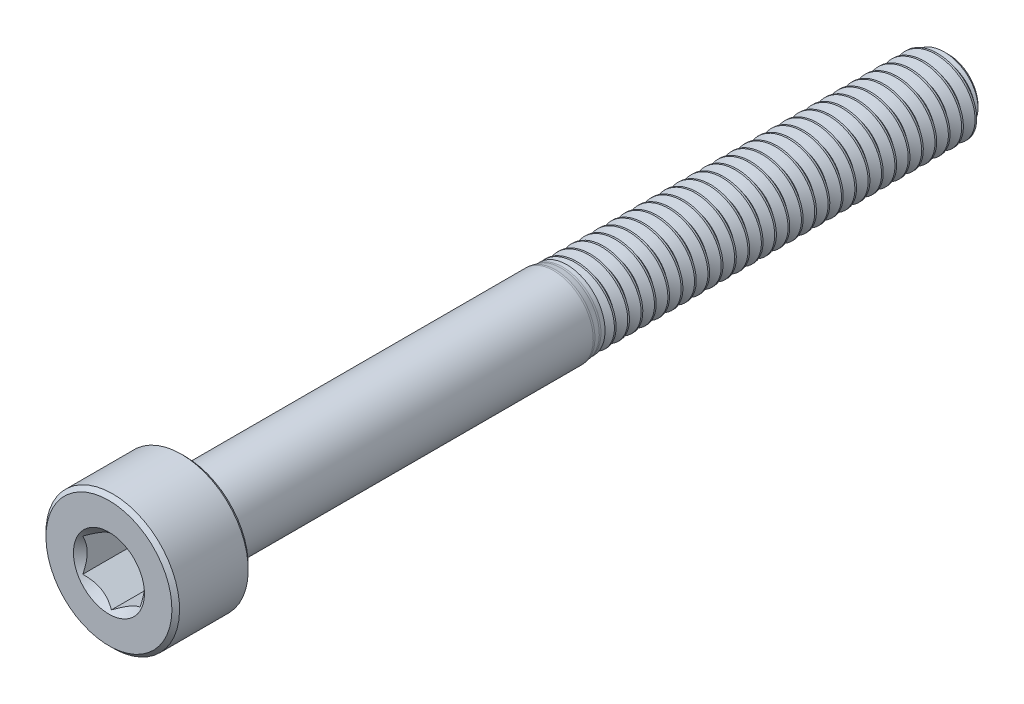
from build123d import *

# Parameters (mm, degrees)
CUT_EXTRUDE1_DEPTH     = 3
SPLIT1_SURFACE_1_BACK  = 46.1
SPLIT1_SURFACE_1_DEPTH = 92.2
SPLIT1_SURFACE_2_BACK  = 46.1
SPLIT1_SURFACE_2_DEPTH = 92.2
CUT_SWEEP1_PITCH       = 0.7
CUT_SWEEP1_TO          = 20


with BuildPart() as part:
    # Sketch2 → Revolve1 (revolve)
    with BuildSketch(Plane(origin=(0, 0, 0), x_dir=(0, 0, -1), z_dir=(1, 0, 0))):
        with BuildLine():
            Line((-22, 0), (-22, 3.3))
            Line((-22, 3.3), (-21.8, 3.5))
            Line((-21.8, 3.5), (-18.2, 3.5))
            Line((-18.2, 3.5), (-18, 3.3))
            Line((-18, 3.3), (-18, 2.275777223))
            ThreePointArc((-18, 2.275777223), (-17.941421356, 2.134355867), (-17.8, 2.075777223))
            Line((-17.8, 2.075777223), (1.307296473, 2.075777223))
            ThreePointArc((1.307296473, 2.075777223), (1.356305044, 2.073369586), (1.404841634, 2.066169863))
            Line((1.404841634, 2.066169863), (1.689200541, 2.00960736))
            ThreePointArc((1.689200541, 2.00960736), (1.737737132, 2.002407637), (1.786745702, 2))
            Line((1.786745702, 2), (21.545336663, 2))
            Line((21.545336663, 2), (22, 1.545336663))
            Line((22, 1.545336663), (22, 0))
            Line((22, 0), (-22, 0))
        make_face()
    revolve(axis=Axis((0, 0, -22), (0, 0, 1)))

    # Sketch3 → Cut-Extrude1 (cut)
    with BuildSketch(Plane.XY.offset(22)):
        Polygon((1.5, -0.866025404), (1.5, 0.866025404), (0, 1.732050808), (-1.5, 0.866025404), (-1.5, -0.866025404), (0, -1.732050808), align=None)
    extrude(amount=-CUT_EXTRUDE1_DEPTH, mode=Mode.SUBTRACT)

    # Cut-Extrude2 cone 1 section (through the dimple's axis) → Cut-Extrude2 (revolve, cut)
    with BuildSketch(Plane(origin=(0, 0, 22), x_dir=(0, -1, 0), z_dir=(1, 0, 0))):
        Polygon((0, 0), (1.861954618, 0), (0, 1.861954618), align=None)
    revolve(axis=Axis((0, 0, 22), (0, 0, -1)), mode=Mode.SUBTRACT)


with BuildPart() as body_2:
    # Split1: the piece behind the surface
    add(part.part)
    # Split1 surface: a surface, the sketch's curves swept straight by 92.2 mm
    with BuildLine(Plane(origin=(0, 0, 0), x_dir=(0, 0, -1), z_dir=(1, 0, 0)).offset(-SPLIT1_SURFACE_1_BACK), mode=Mode.PRIVATE) as split1_surface_1_path:
        Line((2, -2), (2, 2))
    split1_surface_1 = Shell.extrude(split1_surface_1_path.wire(), (1 * SPLIT1_SURFACE_1_DEPTH, 0 * SPLIT1_SURFACE_1_DEPTH, 0 * SPLIT1_SURFACE_1_DEPTH))
    split(bisect_by=split1_surface_1, keep=Keep.BOTTOM)

    # Cut-Sweep1: arcs per turn and ends read off the stored shape
    # Cut-Sweep1: the profile of Sketch7 screwed along a right-hand helix through 29.571429 turns, 6 arcs to a turn; built about Z, then put on its axis
    cut_sweep1_z = Axis((0, 0, 0), (0, 0, 1))
    cut_sweep1_corners = [(2.037888611, 0, 0.021875), (2.037888611, 0, -0.634375), (1.545336663, 0, -0.35), (1.545336663, 0, -0.2625)]
    with BuildLine(mode=Mode.PRIVATE) as cut_sweep1_profile:
        Line(cut_sweep1_corners[0], cut_sweep1_corners[1])
        Line(cut_sweep1_corners[1], cut_sweep1_corners[2])
        Line(cut_sweep1_corners[2], cut_sweep1_corners[3])
        Line(cut_sweep1_corners[3], cut_sweep1_corners[0])
    cut_sweep1_cap = Face(cut_sweep1_profile.wire())
    cut_sweep1_turn_angles = [0, 30, 60, 90, 120, 150, 180, 210, 240, 270, 300, 330, 360]
    cut_sweep1_turn_weights = [1, 0.8660254037844387, 1, 0.8660254037844387, 1, 0.8660254037844387, 1, 0.8660254037844387, 1, 0.8660254037844387, 1, 0.8660254037844387, 1]
    cut_sweep1_turn_rails = [Edge.make_bspline([Vector(p[0], p[1], 0).rotate(cut_sweep1_z, cut_sweep1_turn_angles[k]) / cut_sweep1_turn_weights[k] + Vector(0, 0, p[2] + CUT_SWEEP1_PITCH * cut_sweep1_turn_angles[k] / 360) for k in range(13)], [0, 0, 0, 1, 1, 2, 2, 3, 3, 4, 4, 5, 5, 6, 6, 6], 2, cut_sweep1_turn_weights) for p in cut_sweep1_corners]
    cut_sweep1_turn_sides = [Face.make_surface_from_curves(cut_sweep1_turn_rails[p[0]], cut_sweep1_turn_rails[p[1]]) for p in [(0, 1), (1, 2), (2, 3), (3, 0)]]
    cut_sweep1_last_angles = [10440, 10470, 10500, 10530, 10560, 10590, 10620, 10632.857142857, 10645.714285714]
    cut_sweep1_last_weights = [1, 0.8660254037844387, 1, 0.8660254037844387, 1, 0.8660254037844387, 1, 0.9749279121817342, 1]
    cut_sweep1_last_rails = [Edge.make_bspline([Vector(p[0], p[1], 0).rotate(cut_sweep1_z, cut_sweep1_last_angles[k]) / cut_sweep1_last_weights[k] + Vector(0, 0, p[2] + CUT_SWEEP1_PITCH * cut_sweep1_last_angles[k] / 360) for k in range(9)], [0, 0, 0, 1, 1, 2, 2, 3, 3, 4, 4, 4], 2, cut_sweep1_last_weights) for p in cut_sweep1_corners]
    cut_sweep1_last_sides = [Face.make_surface_from_curves(cut_sweep1_last_rails[p[0]], cut_sweep1_last_rails[p[1]]) for p in [(0, 1), (1, 2), (2, 3), (3, 0)]]
    cut_sweep1 = Plane(origin=(0, 0, -22), x_dir=(0, 1, 0), z_dir=(0, 0, 1)) * split(Solid(Shell([*[p.moved(Location((0, 0, CUT_SWEEP1_PITCH * i))) for i in range(29) for p in cut_sweep1_turn_sides], *cut_sweep1_last_sides, cut_sweep1_cap, cut_sweep1_cap.rotate(cut_sweep1_z, 10645.714285714).moved(Location((0, 0, CUT_SWEEP1_PITCH * 10645.714285714 / 360)))])), bisect_by=Plane.XY.offset(CUT_SWEEP1_TO), keep=Keep.BOTTOM, mode=Mode.PRIVATE)
    add(cut_sweep1, mode=Mode.SUBTRACT)


with BuildPart() as part_1:
    add(part.part)

    # Split1: split by a surface, the side it looks to stays
    # Split1 surface: a surface, the sketch's curves swept straight by 92.2 mm
    with BuildLine(Plane(origin=(0, 0, 0), x_dir=(0, 0, -1), z_dir=(1, 0, 0)).offset(-SPLIT1_SURFACE_2_BACK), mode=Mode.PRIVATE) as split1_surface_2_path:
        Line((2, -2), (2, 2))
    split1_surface_2 = Shell.extrude(split1_surface_2_path.wire(), (1 * SPLIT1_SURFACE_2_DEPTH, 0 * SPLIT1_SURFACE_2_DEPTH, 0 * SPLIT1_SURFACE_2_DEPTH))
    split(bisect_by=split1_surface_2, keep=Keep.TOP)

    add(body_2.part)  # Revolve2 merges body 2
    # Sketch8 → Revolve2 (revolve)
    with BuildSketch(Plane(origin=(0, 0, 0), x_dir=(0, 0, -1), z_dir=(1, 0, 0))):
        Polygon((-18, 0), (-18, 2), (2, 2), (3.154700538, 0), align=None)
    revolve(axis=Axis((0, 0, -3.154700538), (0, 0, 1)))


solid = part_1.part
